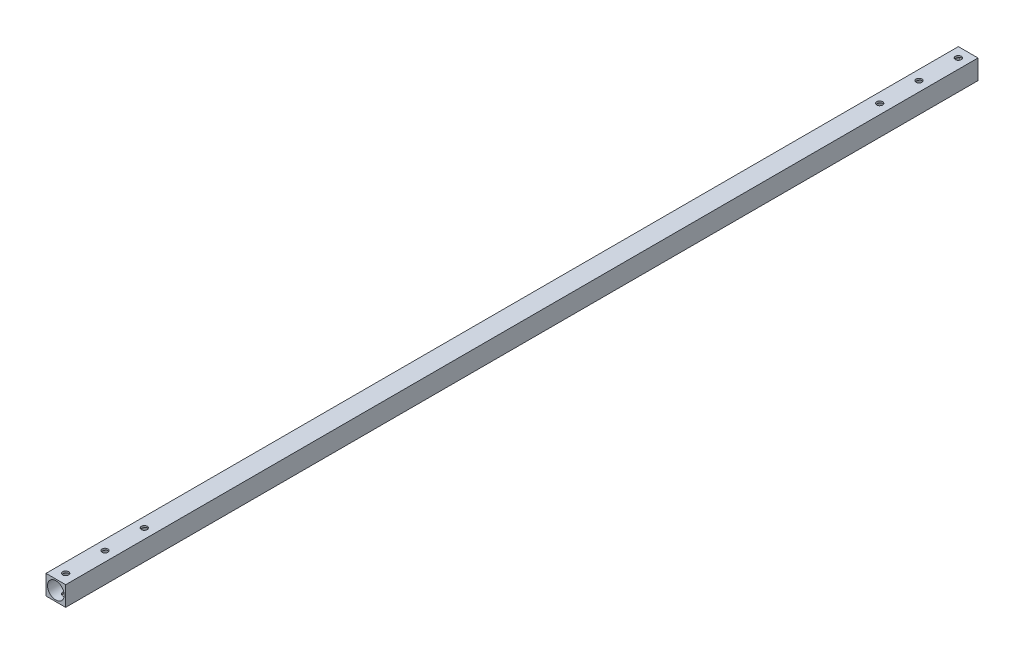
from build123d import *

# Parameters (mm, degrees)
SKETCH1_W           = 10
SKETCH1_H           = 10
SKETCH1_R           = 4.25
BOSS_EXTRUDE1_DEPTH = 464
SKETCH2_R           = 1.5
CUT_EXTRUDE1_DEPTH  = 465.13467873


with BuildPart() as part:
    # Sketch1 → Boss-Extrude1 (new body)
    with BuildSketch(Plane.XY):
        Rectangle(SKETCH1_W, SKETCH1_H)
        Circle(SKETCH1_R, mode=Mode.SUBTRACT)
    extrude(amount=BOSS_EXTRUDE1_DEPTH)

    # Sketch2 → Cut-Extrude1 (cut, through all)
    with BuildSketch(Plane(origin=(0, 5, 0), x_dir=(1, 0, 0), z_dir=(0, 1, 0))):
        with Locations((0, -5)):
            Circle(SKETCH2_R)
        with Locations((0, -25)):
            Circle(SKETCH2_R)
        with Locations((0, -45)):
            Circle(SKETCH2_R)
        with Locations((0, -459)):
            Circle(SKETCH2_R)
        with Locations((0, -439)):
            Circle(SKETCH2_R)
        with Locations((0, -419)):
            Circle(SKETCH2_R)
    extrude(amount=-CUT_EXTRUDE1_DEPTH, mode=Mode.SUBTRACT)


solid = part.part
